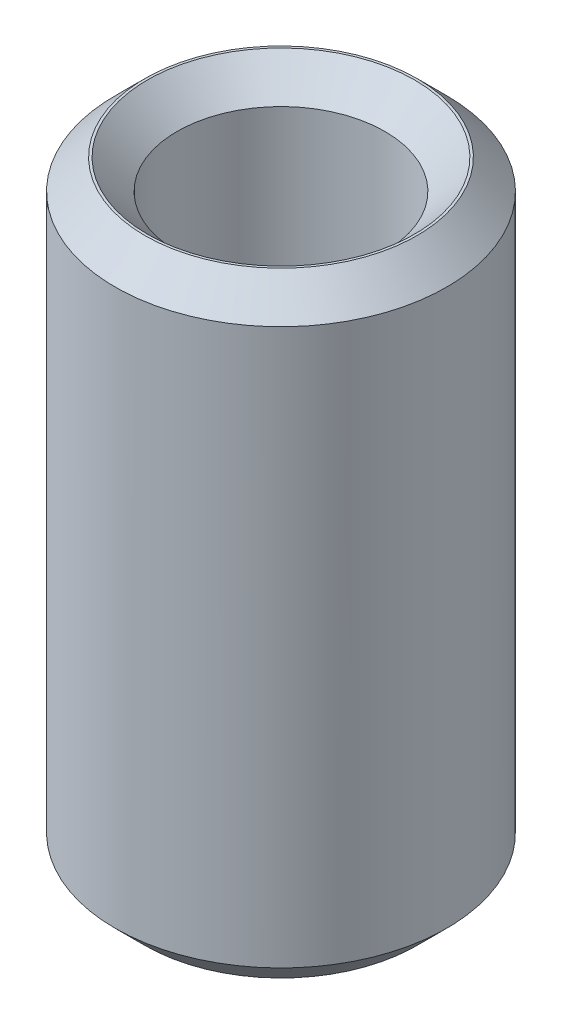
from build123d import *

# Parameters (mm, degrees)
SKETCH1_R           = 15
BOSS_EXTRUDE1_DEPTH = 55.622932544
SKETCH2_R           = 9.401774517
CUT_EXTRUDE1_DEPTH  = 60.530753606
CHAMFER1_SIZE       = 2.688244667


with BuildPart() as part:
    # Sketch1 → Boss-Extrude1 (new body)
    with BuildSketch(Plane(origin=(0, 0, 0), x_dir=(1, 0, 0), z_dir=(0, 1, 0))):
        Circle(SKETCH1_R)
    extrude(amount=BOSS_EXTRUDE1_DEPTH)

    # Sketch2 → Cut-Extrude1 (cut, through all)
    with BuildSketch(Plane(origin=(0, 0, 0), x_dir=(1, 0, 0), z_dir=(0, 1, 0))):
        Circle(SKETCH2_R)
    extrude(amount=CUT_EXTRUDE1_DEPTH, mode=Mode.SUBTRACT)

    # Chamfer1
    chamfer1_edges = [part.edges().sort_by_distance(p)[0] for p in [
        (-9.401774517, 55.622932544, 0),
        (-9.401774517, 0, 0),
        (-15, 0, 0),
        (-15, 55.622932544, 0),
    ]]
    chamfer(chamfer1_edges, length=CHAMFER1_SIZE)


solid = part.part
